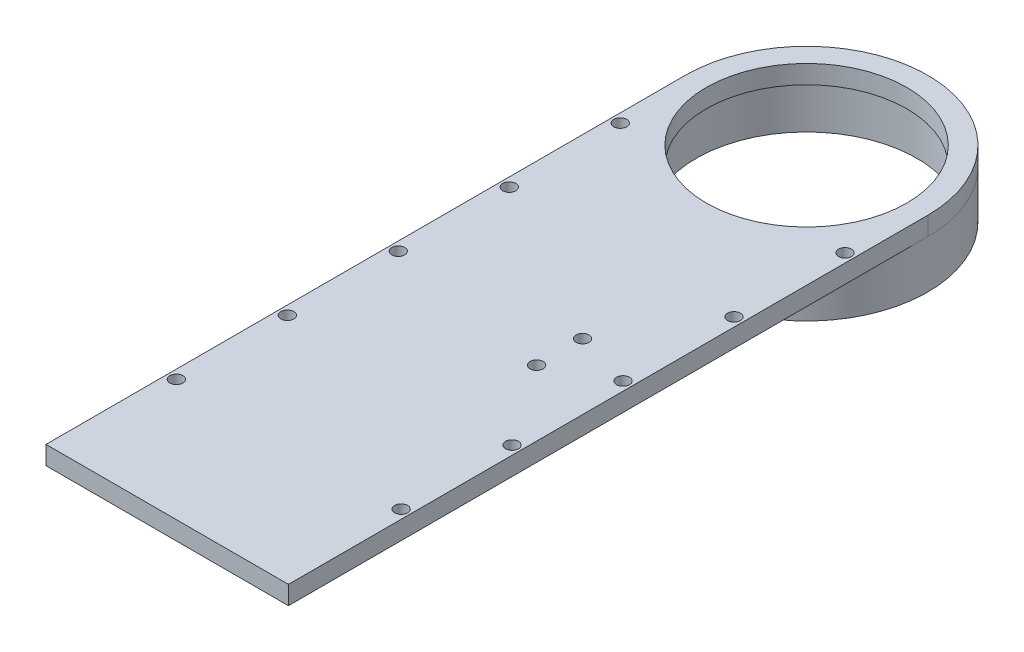
from build123d import *

# Parameters (mm, degrees)
SKETCH1_R            = 2.75
SKETCH1_R_2          = 1.25
SKETCH1_R_3          = 1.75
SKETCH1_R_4          = 4.5
BOSS_EXTRUDE10_DEPTH = 5
SKETCH1_16_R         = 1.25
BOSS_EXTRUDE11_DEPTH = 5
CUT_EXTRUDE5_START   = -17
SKETCH3_R            = 1.75
CUT_EXTRUDE5_DEPTH   = 17
CUT_EXTRUDE7_DEPTH   = 10
SKETCH1_18_R         = 4.5
SKETCH1_18_R_2       = 1.75
BOSS_EXTRUDE12_DEPTH = 5
SKETCH10_R           = 32.76798012
SKETCH10_R_2         = 29.85
BOSS_EXTRUDE13_DEPTH = 13
SKETCH11_R           = 27.095
CUT_EXTRUDE8_DEPTH   = 13
BOSS_EXTRUDE14_DEPTH = 3
SKETCH13_W           = 12
SKETCH13_H           = 4
BOSS_EXTRUDE15_DEPTH = 25
SKETCH14_R           = 1.25
CUT_EXTRUDE9_DEPTH   = 25
FILLET1_R            = 2.5


with BuildPart() as part:
    # Sketch1 → Boss-Extrude10 (new body)
    with BuildSketch(Plane(origin=(0, 0, 0), x_dir=(1, 0, 0), z_dir=(0, 1, 0))):
        with BuildLine():
            Line((-32.774, 177.619546288), (-32.774, -22.380453712))
            ThreePointArc((-32.774, -22.380453712), (0, -55.154453712), (32.774, -22.380453712))
            Line((32.774, -22.380453712), (32.774, 177.619546288))
            ThreePointArc((32.774, 177.619546288), (0, 210.393546288), (-32.774, 177.619546288))
        make_face()
        with Locations((-11.258330249, -28.880453712)):
            Circle(SKETCH1_R, mode=Mode.SUBTRACT)
        with Locations((-11.258330249, -15.880453712)):
            Circle(SKETCH1_R, mode=Mode.SUBTRACT)
        with Locations((-6.733414, 27.619546288)):
            Circle(SKETCH1_R_2, mode=Mode.SUBTRACT)
        with Locations((-6.733414, 37.119546288)):
            Circle(SKETCH1_R_2, mode=Mode.SUBTRACT)
        with Locations((-14.032659813, 67.637846288)):
            Circle(SKETCH1_R_3, mode=Mode.SUBTRACT)
        with Locations((0, -35.380453712)):
            Circle(SKETCH1_R, mode=Mode.SUBTRACT)
        with Locations((11.258330249, -28.880453712)):
            Circle(SKETCH1_R, mode=Mode.SUBTRACT)
        with Locations((0, -9.380453712)):
            Circle(SKETCH1_R, mode=Mode.SUBTRACT)
        with Locations((11.258330249, -15.880453712)):
            Circle(SKETCH1_R, mode=Mode.SUBTRACT)
        with Locations((0, 53.605186475)):
            Circle(SKETCH1_R_3, mode=Mode.SUBTRACT)
        with Locations((14.032659813, 67.637846288)):
            Circle(SKETCH1_R_3, mode=Mode.SUBTRACT)
        with Locations((0, 81.6705061)):
            Circle(SKETCH1_R_3, mode=Mode.SUBTRACT)
        with Locations((15, 89.637846288)):
            Circle(SKETCH1_R_3, mode=Mode.SUBTRACT)
        with Locations((0, 177.619546288)):
            Circle(SKETCH1_R_4, mode=Mode.SUBTRACT)
        with Locations((0, 67.637846288)):
            Circle(SKETCH1_R_4, mode=Mode.SUBTRACT)
    extrude(amount=-BOSS_EXTRUDE10_DEPTH)

    # Sketch1<16> → Boss-Extrude11 (add)
    with BuildSketch(Plane(origin=(0, 0, 0), x_dir=(1, 0, 0), z_dir=(0, 1, 0))):
        with Locations((-6.733414, 37.119546288)):
            Circle(SKETCH1_16_R)
        with Locations((-6.733414, 27.619546288)):
            Circle(SKETCH1_16_R)
    extrude(amount=-BOSS_EXTRUDE11_DEPTH)

    # Sketch3 → Cut-Extrude5 (cut)
    with BuildSketch(Plane.XZ.offset(5).offset(CUT_EXTRUDE5_START)):
        with Locations((15, -89.637846288)):
            Circle(SKETCH3_R)
        with Locations((15, -102.056321071)):
            Circle(SKETCH3_R)
        with Locations((-30.384, -67.619546288)):
            Circle(SKETCH3_R)
        with Locations((-30.384, -37.619546288)):
            Circle(SKETCH3_R)
        with Locations((-30.384, -97.619546288)):
            Circle(SKETCH3_R)
        with Locations((-30.384, -127.619546288)):
            Circle(SKETCH3_R)
        with Locations((-30.384, -157.619546288)):
            Circle(SKETCH3_R)
        with Locations((30.384, -157.619546288)):
            Circle(SKETCH3_R)
        with Locations((30.384, -127.619546288)):
            Circle(SKETCH3_R)
        with Locations((30.384, -97.619546288)):
            Circle(SKETCH3_R)
        with Locations((30.384, -67.619546288)):
            Circle(SKETCH3_R)
        with Locations((30.384, -37.619546288)):
            Circle(SKETCH3_R)
    extrude(amount=CUT_EXTRUDE5_DEPTH, mode=Mode.SUBTRACT)

    # Sketch2 → Cut-Extrude7 (cut)
    with BuildSketch(Plane.XZ):
        with BuildLine():
            Line((-32.774000001, -4.769011255), (32.774000001, -4.769011255))
            Line((32.774000001, -4.769011255), (32.774000001, 22.380453712))
            ThreePointArc((32.774000001, 22.380453712), (0, 55.154453713), (-32.774000001, 22.380453712))
            Line((-32.774000001, 22.380453712), (-32.774000001, -4.769011255))
        make_face()
    extrude(amount=CUT_EXTRUDE7_DEPTH, mode=Mode.SUBTRACT)

    # Sketch1<18> → Boss-Extrude12 (add)
    with BuildSketch(Plane(origin=(0, 0, 0), x_dir=(1, 0, 0), z_dir=(0, 1, 0))):
        with Locations((0, 67.637846288)):
            Circle(SKETCH1_18_R)
        with Locations((0, 53.605186475)):
            Circle(SKETCH1_18_R_2)
        with Locations((-14.032659813, 67.637846288)):
            Circle(SKETCH1_18_R_2)
        with Locations((0, 81.6705061)):
            Circle(SKETCH1_18_R_2)
        with Locations((14.032659813, 67.637846288)):
            Circle(SKETCH1_18_R_2)
    extrude(amount=-BOSS_EXTRUDE12_DEPTH)

    # Sketch10 → Boss-Extrude13 (add)
    with BuildSketch(Plane.XZ.offset(5)):
        with Locations((0, -177.619546288)):
            Circle(SKETCH10_R)
        with Locations((0, -177.619546288)):
            Circle(SKETCH10_R_2, mode=Mode.SUBTRACT)
    extrude(amount=BOSS_EXTRUDE13_DEPTH)

    # Sketch11 → Cut-Extrude8 (cut)
    with BuildSketch(Plane.XZ.offset(5)):
        with Locations((0, -177.619546288)):
            Circle(SKETCH11_R)
    extrude(amount=-CUT_EXTRUDE8_DEPTH, mode=Mode.SUBTRACT)

    # Sketch5 → Boss-Extrude14 (add)
    with BuildSketch(Plane.XZ.offset(5)):
        Polygon((-7.824000001, -54.439091018), (-7.824000001, -50.294800153), (11.225999999, -50.294800153), (11.225999999, -52.737107845), (-5.625923078, -52.737107845), (-5.625923078, -55.667877076), align=None)
        Polygon((-7.824000001, -77.404415537), (-7.824000001, -74.946843422), (6.78786899, -68.867786932), (-7.824000001, -62.792546547), (-7.824000001, -60.308261691), (11.225999999, -68.478544143), (11.225999999, -69.260845826), align=None)
        Polygon((11.225999999, -103.048646307), (-7.824000001, -103.048646307), (-7.824000001, -102.144229239), (6.650489182, -90.592877076), (-7.824000001, -90.592877076), (-7.824000001, -88.150569384), (11.225999999, -88.150569384), (11.225999999, -89.150389095), (-3.210328126, -100.606338614), (11.225999999, -100.606338614), align=None)
        with BuildLine():
            Line((-7.824000001, -110.131338614), (-7.824000001, -107.689030922))
            Line((-7.824000001, -107.689030922), (4.963770432, -107.689030922))
            add(Edge.make_bspline(
                [(4.963770432, -107.689030922), (5.195284298, -107.690885051), (5.64058499, -107.694451338), (6.282127583, -107.710622767), (6.869902619, -107.750196634), (7.404321802, -107.799507581), (7.886610584, -107.856591103), (8.313879678, -107.93850968), (8.689949893, -108.026630447), (9.116491069, -108.169153007), (9.595339884, -108.393934907), (10.111712604, -108.751940741), (10.571673312, -109.196571131), (10.907530608, -109.628416016), (11.13794534, -110.012545465), (11.297510075, -110.317623544), (11.424793799, -110.643597173), (11.533834774, -110.983321068), (11.610882457, -111.340471014), (11.674764914, -111.711796449), (11.707736212, -112.10111909), (11.712193771, -112.36625392), (11.714461538, -112.501140297)],
                knots=[0, 0, 0, 0, 1.452629871, 2.794031722, 4.025694375, 5.147841271, 6.161522649, 7.070971626, 7.876222586, 8.582890533, 9.889534196, 11.180212824, 12.506716644, 13.889181747, 14.598189363, 15.315636514, 16.046279605, 16.790911698, 17.551832231, 18.336450274, 19.153675152, 20, 20, 20, 20], degree=3))
            add(Edge.make_bspline(
                [(11.714461538, -112.501140297), (11.709715065, -112.690996015), (11.700270364, -113.068777754), (11.611584234, -113.632488096), (11.470780234, -114.18810384), (11.271570837, -114.74809611), (10.996525721, -115.32564021), (10.608190367, -115.923011587), (10.131794371, -116.566713359), (9.758962639, -116.990402865), (9.562177884, -117.214030922)],
                knots=[0, 0, 0, 0, 0.856972921, 1.705235559, 2.570545082, 3.44278821, 4.385852251, 5.452194716, 6.655239899, 8, 8, 8, 8], degree=3))
            Line((9.562177884, -117.214030922), (7.80676923, -116.004325393))
            add(Edge.make_bspline(
                [(7.80676923, -116.004325393), (7.894907738, -115.863356861), (8.065044953, -115.59123978), (8.304537659, -115.195035974), (8.521847451, -114.828568699), (8.718040268, -114.494300424), (8.884251955, -114.186630498), (9.035266134, -113.914342494), (9.157620565, -113.667523035), (9.230416916, -113.512520303), (9.264521634, -113.439902316)],
                knots=[0, 0, 0, 0, 1.35182785, 2.609486248, 3.764263372, 4.816267098, 5.760612529, 6.607550145, 7.347644362, 8, 8, 8, 8], degree=3))
            add(Edge.make_bspline(
                [(9.264521634, -113.439902316), (9.30296182, -113.348904612), (9.376646938, -113.174473182), (9.457997196, -112.91437331), (9.506417053, -112.668323997), (9.513151386, -112.508961908), (9.516384615, -112.432450393)],
                knots=[0, 0, 0, 0, 1.132993667, 2.17180979, 3.122265503, 4, 4, 4, 4], degree=3))
            add(Edge.make_bspline(
                [(9.516384615, -112.432450393), (9.511267111, -112.318803952), (9.501130651, -112.093699551), (9.419283826, -111.764584671), (9.277522501, -111.45621453), (9.090739979, -111.16641845), (8.859379113, -110.901782723), (8.578900769, -110.678865607), (8.260942683, -110.493691853), (7.958995713, -110.380505827), (7.682179611, -110.302721603), (7.423123036, -110.262354362), (7.119487359, -110.218405126), (6.769344681, -110.184594649), (6.372022147, -110.164686683), (5.928147668, -110.144130246), (5.438290975, -110.133455838), (5.096065936, -110.13206328), (4.917977163, -110.131338614)],
                knots=[0, 0, 0, 0, 0.938055486, 1.858046901, 2.779836698, 3.729995872, 4.697713164, 5.669188152, 6.676648582, 7.724504959, 8.32352458, 9.04907482, 9.887175513, 10.858480013, 11.953077028, 13.173078688, 14.528912581, 16, 16, 16, 16], degree=3))
            Line((4.917977163, -110.131338614), (-7.824000001, -110.131338614))
        make_face()
    extrude(amount=BOSS_EXTRUDE14_DEPTH)

    # Sketch13 → Boss-Extrude15 (add)
    with BuildSketch(Plane.XZ.offset(5)):
        with Locations((0.000999999, -123.10114465)):
            Rectangle(SKETCH13_W, SKETCH13_H)
    extrude(amount=BOSS_EXTRUDE15_DEPTH)

    # Sketch14 → Cut-Extrude9 (cut)
    with BuildSketch(Plane(origin=(0, 0, -125.10114465), x_dir=(-1, 0, 0), z_dir=(0, 0, -1))):
        with Locations((0, -22.5)):
            Circle(SKETCH14_R)
        with Locations((0, -13)):
            Circle(SKETCH14_R)
    extrude(amount=-CUT_EXTRUDE9_DEPTH, mode=Mode.SUBTRACT)

    # Fillet1
    fillet1_edges = [part.edges().sort_by_distance(p)[0] for p in [
        (6.000999999, -30, -123.10114465),
        (-5.999000001, -30, -123.10114465),
        (-5.999000001, -5, -123.10114465),
        (6.000999999, -5, -123.10114465),
    ]]
    fillet(fillet1_edges, radius=FILLET1_R)


solid = part.part
